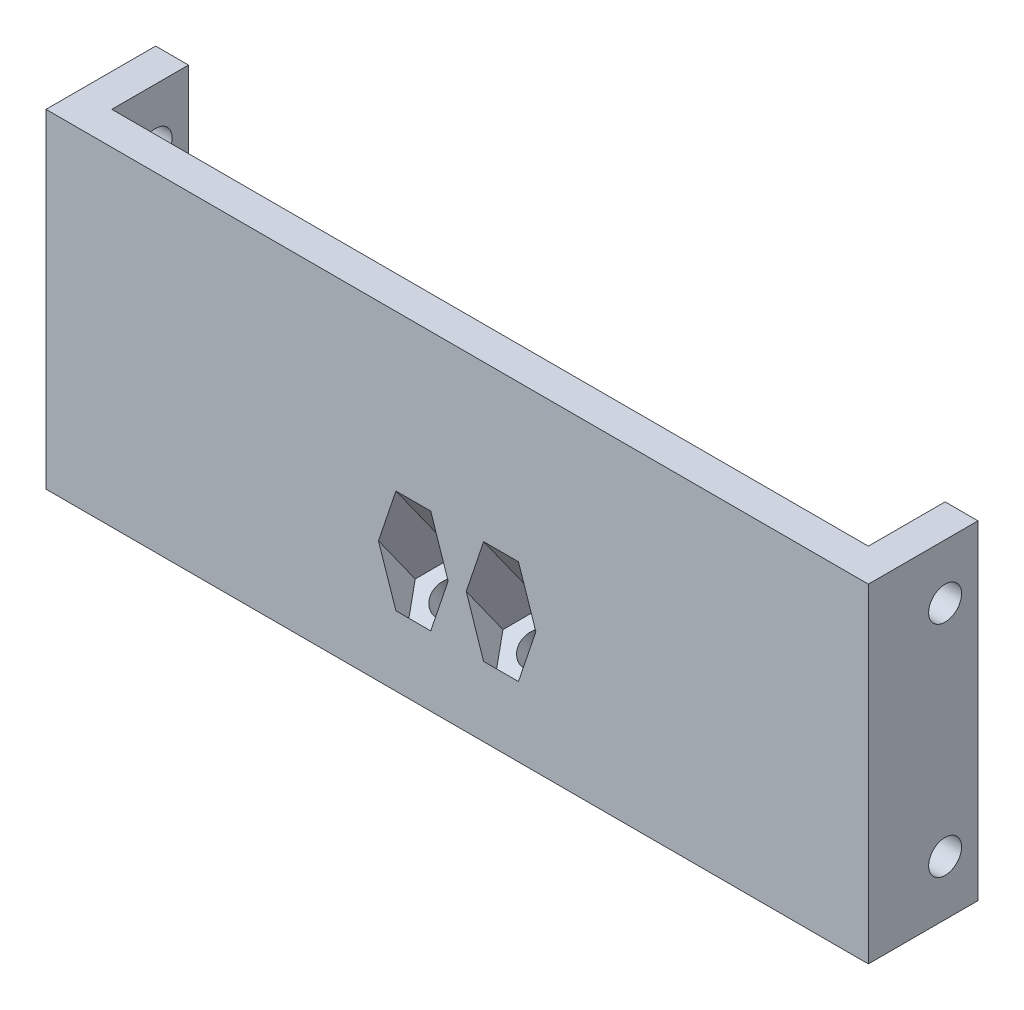
from build123d import *

# Parameters (mm, degrees)
SKETCH1_W               = 75
SKETCH1_H               = 30
BOSS_EXTRUDE1_DEPTH     = 3
SKETCH2_W               = 3
SKETCH2_H               = 30
BOSS_EXTRUDE2_DEPTH     = 7
SKETCH4_R               = 1.5
CUT_EXTRUDE1_DEPTH      = 3
MIRROR1_COPY_1_SKETCH_R = 1.5
MIRROR1_COPY_1_DEPTH    = 3
SKETCH5_W               = 16
SKETCH5_H               = 7
BOSS_EXTRUDE3_DEPTH     = 8
CHAMFER1_SIZE           = 5
CHAMFER1_SIZE2          = 7
CHAMFER2_SIZE           = 5
CHAMFER3_SIZE           = 2
SKETCH6_R               = 1.5
CUT_EXTRUDE2_DEPTH      = 8
CUT_EXTRUDE3_START      = -5
CUT_EXTRUDE3_DEPTH      = 42.149507332


with BuildPart() as part:
    # Sketch1 → Boss-Extrude1 (new body)
    with BuildSketch(Plane.XY):
        Rectangle(SKETCH1_W, SKETCH1_H)
    extrude(amount=BOSS_EXTRUDE1_DEPTH)

    # Sketch2 → Boss-Extrude2 (add)
    with BuildSketch(Plane(origin=(0, 0, 0), x_dir=(-1, 0, 0), z_dir=(0, 0, -1))):
        with Locations((-36, 0)):
            Rectangle(SKETCH2_W, SKETCH2_H)
    boss_extrude2 = extrude(amount=BOSS_EXTRUDE2_DEPTH)

    # Sketch4 → Cut-Extrude1 (cut)
    with BuildSketch(Plane.ZY.offset(-34.5)):
        with Locations((-4, 10)):
            Circle(SKETCH4_R)
    cut_extrude1 = extrude(amount=-CUT_EXTRUDE1_DEPTH, mode=Mode.SUBTRACT)

    # Mirror2: Cut-Extrude1 across plane
    add(cut_extrude1.mirror(Plane.ZX), mode=Mode.SUBTRACT)

    # Mirror1: Boss-Extrude2, Cut-Extrude1 across plane
    add(boss_extrude2.mirror(Plane(origin=(0, 0, 0), x_dir=(0, 0, 1), z_dir=(1, 0, 0))))
    add(cut_extrude1.mirror(Plane(origin=(0, 0, 0), x_dir=(0, 0, 1), z_dir=(1, 0, 0))), mode=Mode.SUBTRACT)

    # Mirror1 copy 1 sketch → Mirror1 copy 1 (cut)
    with BuildSketch(Plane(origin=(-34.5, 0, 0), x_dir=(0, 0, 1), z_dir=(1, 0, 0))):
        with Locations((-4, 10)):
            Circle(MIRROR1_COPY_1_SKETCH_R)
    extrude(amount=-MIRROR1_COPY_1_DEPTH, mode=Mode.SUBTRACT)

    # Sketch5 → Boss-Extrude3 (add)
    with BuildSketch(Plane.XZ.offset(15)):
        with Locations((0, -3.5)):
            Rectangle(SKETCH5_W, SKETCH5_H)
    extrude(amount=-BOSS_EXTRUDE3_DEPTH)

    # Chamfer1
    chamfer1_edges = [part.edges().sort_by_distance(p)[0] for p in [
        (0, -15, -7),
    ]]
    chamfer1_side = [part.faces().sort_by_distance(p)[0] for p in [
        (0, -11, -7),
    ]]
    chamfer(chamfer1_edges, length=CHAMFER1_SIZE, length2=CHAMFER1_SIZE2, reference=chamfer1_side[0])

    # Chamfer2
    chamfer2_edges = [part.edges().sort_by_distance(p)[0] for p in [
        (0, -7, 0),
    ]]
    chamfer(chamfer2_edges, length=CHAMFER2_SIZE)

    # Chamfer3
    chamfer3_edges = [part.edges().sort_by_distance(p)[0] for p in [
        (0, -7, -7),
    ]]
    chamfer(chamfer3_edges, length=CHAMFER3_SIZE - 0.0001)  # a hair under: the kernel refuses the full size

    # Sketch6 → Cut-Extrude2 (cut)
    with BuildSketch(Plane(origin=(0, -9.932432432, -7.094594595), x_dir=(1, 0, 0), z_dir=(0, -0.8137334712067358, -0.5812381937190955))):
        with Locations(Location((-4, 4.718572906, 0), (0, 0, 270))):
            Circle(SKETCH6_R)
        with Locations(Location((4, 4.718572906, 0), (0, 0, 270))):
            Circle(SKETCH6_R)
    extrude(amount=-CUT_EXTRUDE2_DEPTH, mode=Mode.SUBTRACT)

    # Sketch7 → Cut-Extrude3 (cut, through all)
    with BuildSketch(Plane(origin=(0, -9.932432432, -7.094594595), x_dir=(1, 0, 0), z_dir=(0, -0.8137334712067358, -0.5812381937190955)).offset(CUT_EXTRUDE3_START)):
        Polygon((-0.824573519, 4.718572906), (-2.41228676, 7.468572906), (-5.58771324, 7.468572906), (-7.175426481, 4.718572906), (-5.58771324, 1.968572906), (-2.41228676, 1.968572906), align=None)
        Polygon((7.175426481, 4.718572906), (5.58771324, 7.468572906), (2.41228676, 7.468572906), (0.824573519, 4.718572906), (2.41228676, 1.968572906), (5.58771324, 1.968572906), align=None)
    extrude(amount=-CUT_EXTRUDE3_DEPTH, mode=Mode.SUBTRACT)


solid = part.part
